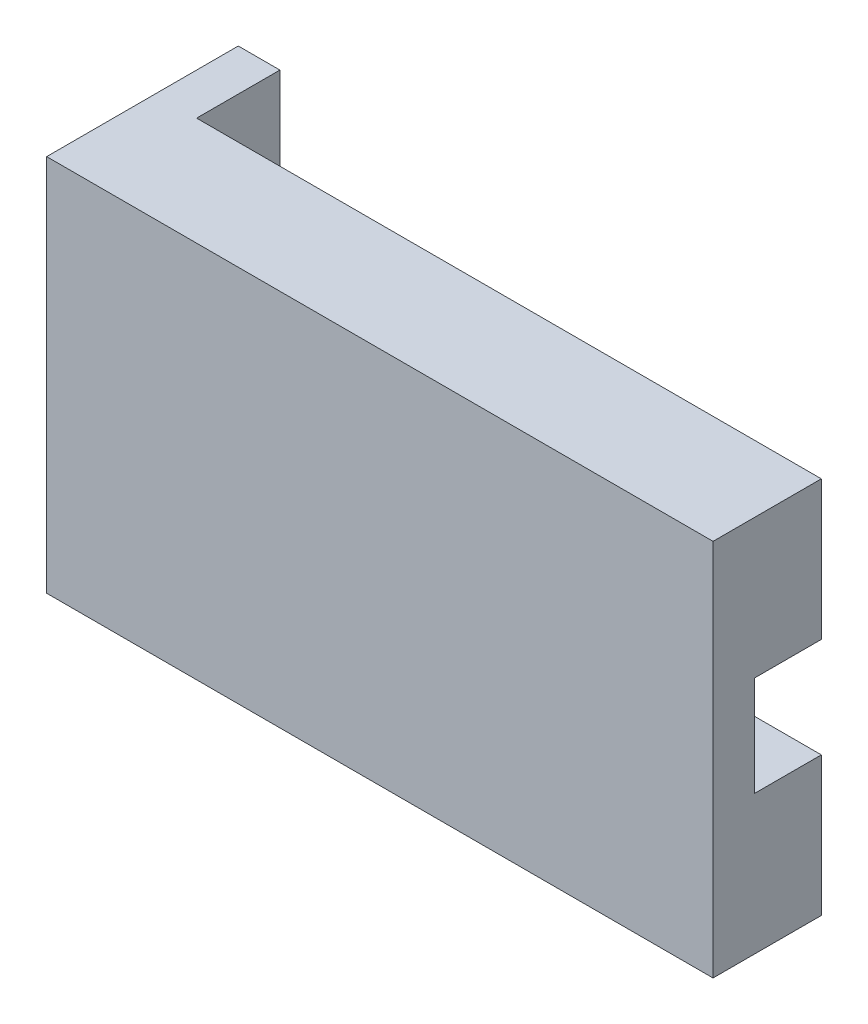
from build123d import *

# Parameters (mm, degrees)
SKETCH1_W               = 80
SKETCH1_H               = 45.4
BOSS_EXTRUDE1_DEPTH     = 13
SKETCH2_W               = 5
SKETCH2_H               = 45.4
BOSS_EXTRUDE2_DEPTH     = 10
CUT_EXTRUDE1_DEPTH      = 8
CUT_EXTRUDE1_DEPTH_BACK = 93.898654457
SKETCH3_W               = 80
SKETCH3_H               = 12


with BuildPart() as part:
    # Sketch1 → Boss-Extrude1 (new body)
    with BuildSketch(Plane.XY):
        with Locations((40, 22.7)):
            Rectangle(SKETCH1_W, SKETCH1_H)
    extrude(amount=BOSS_EXTRUDE1_DEPTH)

    # Sketch2 → Boss-Extrude2 (add)
    with BuildSketch(Plane(origin=(0, 0, 0), x_dir=(-1, 0, 0), z_dir=(0, 0, -1))):
        with Locations((-2.5, 22.7)):
            Rectangle(SKETCH2_W, SKETCH2_H)
    extrude(amount=BOSS_EXTRUDE2_DEPTH)

    # Sketch3 → Cut-Extrude1 (cut, two sides: drawn at the far end of the back side and taken through both)
    with BuildSketch(Plane.XY.offset(-CUT_EXTRUDE1_DEPTH_BACK)):
        with Locations((40, 22.7)):
            Rectangle(SKETCH3_W, SKETCH3_H)
    extrude(amount=CUT_EXTRUDE1_DEPTH + CUT_EXTRUDE1_DEPTH_BACK, mode=Mode.SUBTRACT)


solid = part.part
